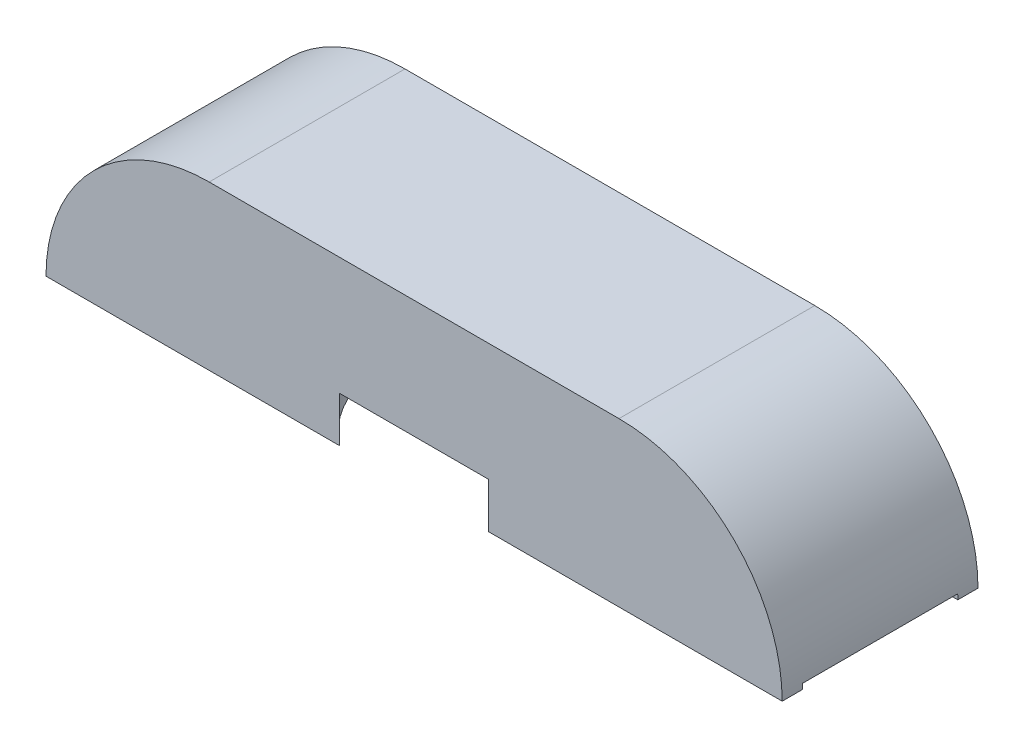
from build123d import *

# Parameters (mm, degrees)
SKETCH1_W                = 90.23
SKETCH1_H                = 24
BOSS_EXTRUDE1_DEPTH      = 20
FILLET1_R                = 20
SKETCH2_W                = 6.48
SKETCH2_H                = 19.05
CUT_EXTRUDE1_DEPTH       = 0.64
M2_CLEARANCE_HOLE1_D     = 2.6
M2_CLEARANCE_HOLE1_DEPTH = 2
M2_CLEARANCE_HOLE1_TIP   = 0.781118805
SKETCH5_R                = 15.08
CUT_EXTRUDE2_DEPTH       = 5.56
SKETCH6_R                = 11.905
CUT_EXTRUDE3_DEPTH       = 11.1


with BuildPart() as part:
    # Sketch1 → Boss-Extrude1 (new body)
    with BuildSketch(Plane(origin=(0, 0, 0), x_dir=(1, 0, 0), z_dir=(0, 1, 0))):
        Rectangle(SKETCH1_W, SKETCH1_H)
    extrude(amount=BOSS_EXTRUDE1_DEPTH)

    # Fillet1
    fillet1_edges = [part.edges().sort_by_distance(p)[0] for p in [
        (45.115, 20, 0),
        (-45.115, 20, 0),
    ]]
    fillet(fillet1_edges, radius=FILLET1_R - 0.0001)  # a hair under: the kernel refuses the full size

    # Sketch2 → Cut-Extrude1 (cut)
    with BuildSketch(Plane.XZ):
        with Locations((41.875, 0)):
            Rectangle(SKETCH2_W, SKETCH2_H)
    extrude(amount=-CUT_EXTRUDE1_DEPTH, mode=Mode.SUBTRACT)

    # M2 Clearance Hole1
    with Locations(Plane(origin=(0, 0.64, 0), x_dir=(-1, 0, 0), z_dir=(0, -1, 0))):
        with Locations((-41.875, 5.565), (-41.875, -5.565)):
            Hole(M2_CLEARANCE_HOLE1_D / 2, depth=M2_CLEARANCE_HOLE1_DEPTH)
            with Locations((0, 0, -(M2_CLEARANCE_HOLE1_DEPTH + M2_CLEARANCE_HOLE1_TIP / 2))):  # 118° drill point
                Cone(0, M2_CLEARANCE_HOLE1_D / 2, M2_CLEARANCE_HOLE1_TIP, mode=Mode.SUBTRACT)

    # Sketch5 → Cut-Extrude2 (cut)
    with BuildSketch(Plane.XZ):
        Circle(SKETCH5_R)
    extrude(amount=-CUT_EXTRUDE2_DEPTH, mode=Mode.SUBTRACT)

    # Sketch6 → Cut-Extrude3 (cut)
    with BuildSketch(Plane.XZ.offset(-5.56)):
        with Locations(Location((0, 0, 0), (0, 0, 270))):
            Circle(SKETCH6_R)
    extrude(amount=-CUT_EXTRUDE3_DEPTH, mode=Mode.SUBTRACT)


solid = part.part
